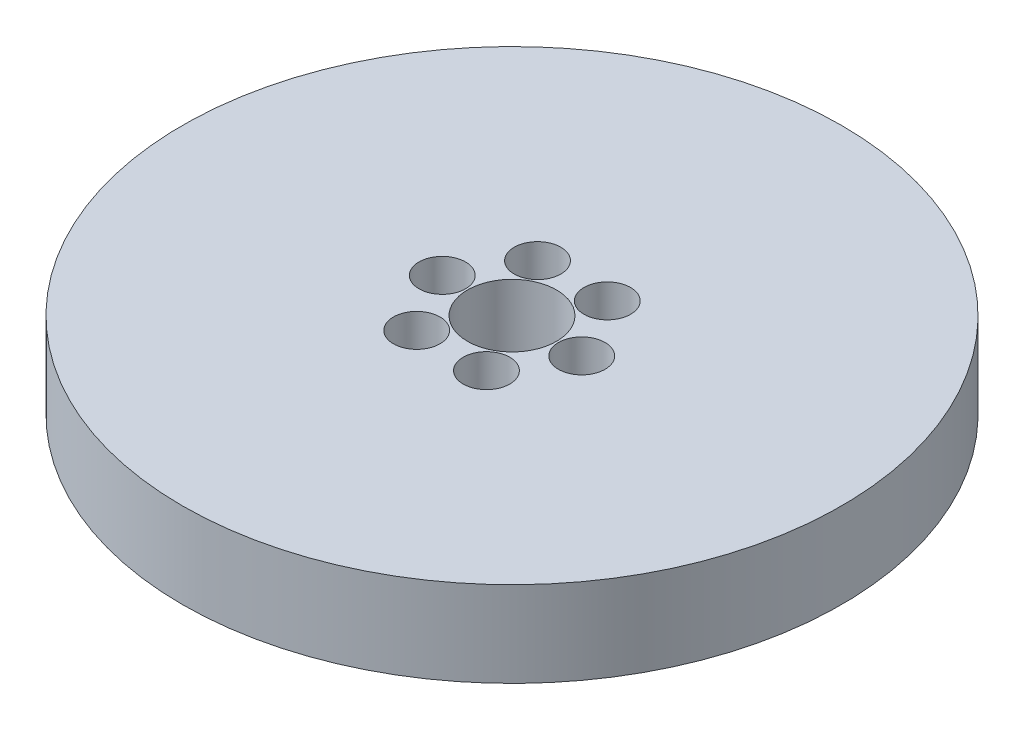
from build123d import *

# Parameters (mm, degrees)
SKETCH1_R           = 92.5
BOSS_EXTRUDE1_DEPTH = 24
SKETCH2_R           = 12.5
CUT_EXTRUDE1_DEPTH  = 133.998120287
SKETCH3_R           = 6.538582323
CUT_EXTRUDE2_DEPTH  = 18.409821693
CIRPATTERN1_COUNT   = 6


with BuildPart() as part:
    # Sketch1 → Boss-Extrude1 (new body)
    with BuildSketch(Plane(origin=(0, 0, 0), x_dir=(1, 0, 0), z_dir=(0, 1, 0))):
        Circle(SKETCH1_R)
    extrude(amount=BOSS_EXTRUDE1_DEPTH)

    # Sketch2 → Cut-Extrude1 (cut, through all)
    with BuildSketch(Plane(origin=(0, 0, 0), x_dir=(1, 0, 0), z_dir=(0, 1, 0))):
        Circle(SKETCH2_R)
    extrude(amount=CUT_EXTRUDE1_DEPTH, mode=Mode.SUBTRACT)

    # Sketch3 → Cut-Extrude2 (cut)
    with BuildSketch(Plane(origin=(0, 24, 0), x_dir=(1, 0, 0), z_dir=(0, 1, 0))):
        with Locations((-19.576447446, 0)):
            Circle(SKETCH3_R)
    cut_extrude2 = extrude(amount=-CUT_EXTRUDE2_DEPTH, mode=Mode.SUBTRACT)

    # CirPattern1: Cut-Extrude2 ×6 about axis
    cirpattern1_axis = Axis((0, 0, 0), (0, 1, 0))
    for i in range(1, CIRPATTERN1_COUNT):
        add(cut_extrude2.rotate(cirpattern1_axis, i * 360 / CIRPATTERN1_COUNT), mode=Mode.SUBTRACT)


solid = part.part
